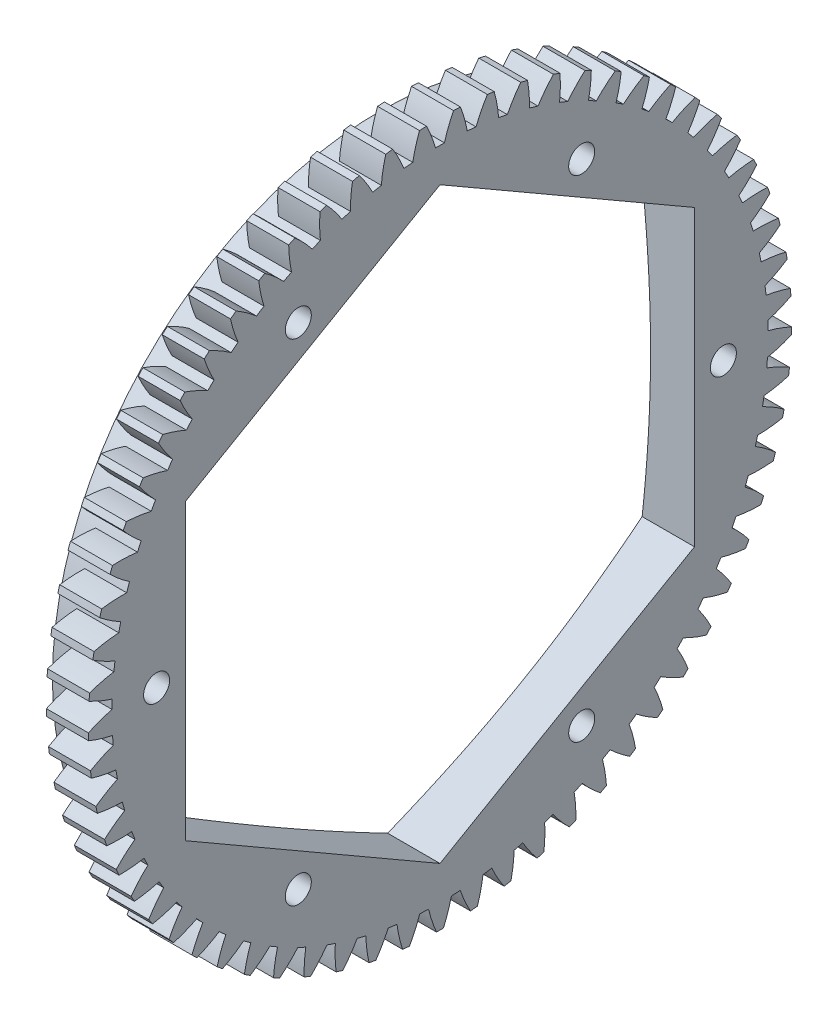
from build123d import *
from build123d.topology import SkipClean

# Parameters (mm, degrees)
BASPROSKE_W             = 12
BASPROSKE_H             = 83.75
TOOTHCUT_DEPTH          = 120.046734521
TEETHCUTS_COUNT         = 65
TEETHCUTS_ANGLE         = 354.461538462
BORSKE_R                = 70
BORE_DEPTH              = 50.0000508
SALIENTE_EXTRUIR1_START = -12
SALIENTE_EXTRUIR1_DEPTH = 12
CROQUIS4_R              = 3.1
CORTAR_EXTRUIR1_DEPTH   = 12
SALIENTE_EXTRUIR2_START = 6
CROQUIS5_R              = 78.124
CROQUIS5_R_2            = 60.621778265
SALIENTE_EXTRUIR2_DEPTH = 6
CHAFL_N1_SIZE           = 26
CHAFL_N1_SIZE_2         = 5.526470603
CORTAR_EXTRUIR3_DEPTH   = 51
CORTAR_EXTRUIR4_START   = -51
CROQUIS10_R             = 3.1
CORTAR_EXTRUIR4_DEPTH   = 51
CROQUIS11_R             = 94.999091288
CORTAR_EXTRUIR5_DEPTH   = 2


with BuildPart() as part:
    # BasProSke → Base-Revolve (revolve)
    with BuildSketch(Plane(origin=(0, 0, 0), x_dir=(1, 0, 0), z_dir=(0, 1, 0)), mode=Mode.PRIVATE) as base_revolve_sk:
        with Locations((6, 41.875)):
            Rectangle(BASPROSKE_W, BASPROSKE_H)
    revolve(base_revolve_sk.sketch.rotate(Axis((-10, 0, 0), (1, 0, 0)), 180), axis=Axis((-10, 0, 0), (1, 0, 0)))

    # TooCutSke → ToothCut (cut, through all)
    with BuildSketch(Plane(origin=(0, 0, 0), x_dir=(0, 0, -1), z_dir=(1, 0, 0))):
        with BuildLine():
            ThreePointArc((1.055025077, 78.116875885), (0, 78.124), (-1.055025077, 78.116875885))
            ThreePointArc((-1.055025077, 78.116875885), (-2.014243555, 80.965342372), (-3.232507799, 83.713012958))
            ThreePointArc((-3.232507799, 83.713012958), (0, 83.7754), (3.232507799, 83.713012958))
            ThreePointArc((3.232507799, 83.713012958), (2.014243555, 80.965342372), (1.055025077, 78.116875885))
        make_face()
    toothcut = extrude(amount=TOOTHCUT_DEPTH, mode=Mode.SUBTRACT)

    # TeethCuts: ToothCut ×65 about axis
    teethcuts_axis = Axis((-10, 0, 0), (1, 0, 0))
    for i in range(1, TEETHCUTS_COUNT):
        add(toothcut.rotate(teethcuts_axis, i * TEETHCUTS_ANGLE / (TEETHCUTS_COUNT - 1)), mode=Mode.SUBTRACT)

    # BorSke → Bore (cut, symmetric)
    with BuildSketch(Plane(origin=(0, 0, 0), x_dir=(0, 0, -1), z_dir=(1, 0, 0))):
        with Locations(Location((0, 0, 0), (0, 0, 180))):
            Circle(BORSKE_R)
    extrude(amount=BORE_DEPTH, both=True, mode=Mode.SUBTRACT)

    # Croquis3 → Saliente-Extruir1 (add)
    with BuildSketch(Plane.ZY.offset(SALIENTE_EXTRUIR1_START)):
        with BuildLine():
            Line((-60.621778265, -35), (-60.621778265, 35))
            ThreePointArc((-60.621778265, 35), (-70, 0), (-60.621778265, -35))
        make_face()
        with BuildLine():
            Line((-60.621778265, 35), (0, 70))
            ThreePointArc((0, 70), (-35, 60.621778265), (-60.621778265, 35))
        make_face()
        with BuildLine():
            ThreePointArc((60.621778265, 35), (35, 60.621778265), (0, 70))
            Line((0, 70), (60.621778265, 35))
        make_face()
        with BuildLine():
            ThreePointArc((70, 0), (67.61480784, 18.117333157), (60.621778265, 35))
            Line((60.621778265, 35), (60.621778265, -35))
            ThreePointArc((60.621778265, -35), (67.61480784, -18.117333157), (70, 0))
        make_face()
        with BuildLine():
            ThreePointArc((0, -70), (35, -60.621778265), (60.621778265, -35))
            Line((60.621778265, -35), (0, -70))
        make_face()
        with BuildLine():
            Line((0, -70), (-60.621778265, -35))
            ThreePointArc((-60.621778265, -35), (-35, -60.621778265), (0, -70))
        make_face()
    extrude(amount=SALIENTE_EXTRUIR1_DEPTH)

    # Croquis4 → Cortar-Extruir1 (cut)
    with BuildSketch(Plane.ZY):
        with Locations((-33.75, 58.456714755)):
            Circle(CROQUIS4_R)
        with Locations((33.75, 58.456714755)):
            Circle(CROQUIS4_R)
        with Locations((67.5, 0)):
            Circle(CROQUIS4_R)
        with Locations((33.75, -58.456714755)):
            Circle(CROQUIS4_R)
        with Locations((-33.75, -58.456714755)):
            Circle(CROQUIS4_R)
        with Locations((-67.5, 0)):
            Circle(CROQUIS4_R)
    extrude(amount=-CORTAR_EXTRUIR1_DEPTH, mode=Mode.SUBTRACT)

    # Croquis5 → Saliente-Extruir2 (add)
    with SkipClean():  # the faces are left unmerged after this step: merging them gives an invalid solid
        with BuildSketch(Plane.ZY.offset(SALIENTE_EXTRUIR2_START)):
            Circle(CROQUIS5_R)
            Circle(CROQUIS5_R_2, mode=Mode.SUBTRACT)
        extrude(amount=-SALIENTE_EXTRUIR2_DEPTH)

    # Chaflán1
    # the kernel refuses this chamfer: 26, 5.526470603 mm, written as the material it takes off along each edge
    with BuildSketch(Plane(origin=(-6, 0, 0), x_dir=(0, 0, 1), z_dir=(0, -1, 0))) as chafl_n1_piece_1:
        Polygon((60.621778265 + CHAFL_N1_SIZE, 0), (60.621778265, -CHAFL_N1_SIZE_2), (60.621778265, 0), align=None)
    revolve(axis=Axis((-6, 0, 0), (-1, 0, 0)), mode=Mode.SUBTRACT)

    # Croquis7 → Cortar-Extruir3 (cut)
    with BuildSketch(Plane(origin=(0, 0, 0), x_dir=(0, 0, -1), z_dir=(1, 0, 0))):
        Polygon((-60.621778265, 35), (-60.621778265, -35), (0, -70), (60.621778265, -35), (60.621778265, 35), (0, 70), align=None)
    extrude(amount=-CORTAR_EXTRUIR3_DEPTH, mode=Mode.SUBTRACT)

    # Croquis10 → Cortar-Extruir4 (cut)
    with BuildSketch(Plane(origin=(0, 0, 0), x_dir=(0, 0, -1), z_dir=(1, 0, 0)).offset(CORTAR_EXTRUIR4_START)):
        with Locations(Location((-67.5, 0, 0), (0, 0, 180))):
            Circle(CROQUIS10_R)
        with Locations(Location((-33.75, 58.456714755, 0), (0, 0, 180))):
            Circle(CROQUIS10_R)
        with Locations(Location((33.75, 58.456714755, 0), (0, 0, 180))):
            Circle(CROQUIS10_R)
        with Locations(Location((67.5, 0, 0), (0, 0, 180))):
            Circle(CROQUIS10_R)
        with Locations(Location((-33.75, -58.456714755, 0), (0, 0, 180))):
            Circle(CROQUIS10_R)
        with Locations(Location((33.75, -58.456714755, 0), (0, 0, 180))):
            Circle(CROQUIS10_R)
    extrude(amount=CORTAR_EXTRUIR4_DEPTH, mode=Mode.SUBTRACT)

    # Croquis11 → Cortar-Extruir5 (cut)
    with BuildSketch(Plane(origin=(12, 0, 0), x_dir=(0, 0, -1), z_dir=(1, 0, 0))):
        Circle(CROQUIS11_R)
    extrude(amount=-CORTAR_EXTRUIR5_DEPTH, mode=Mode.SUBTRACT)


solid = part.part
